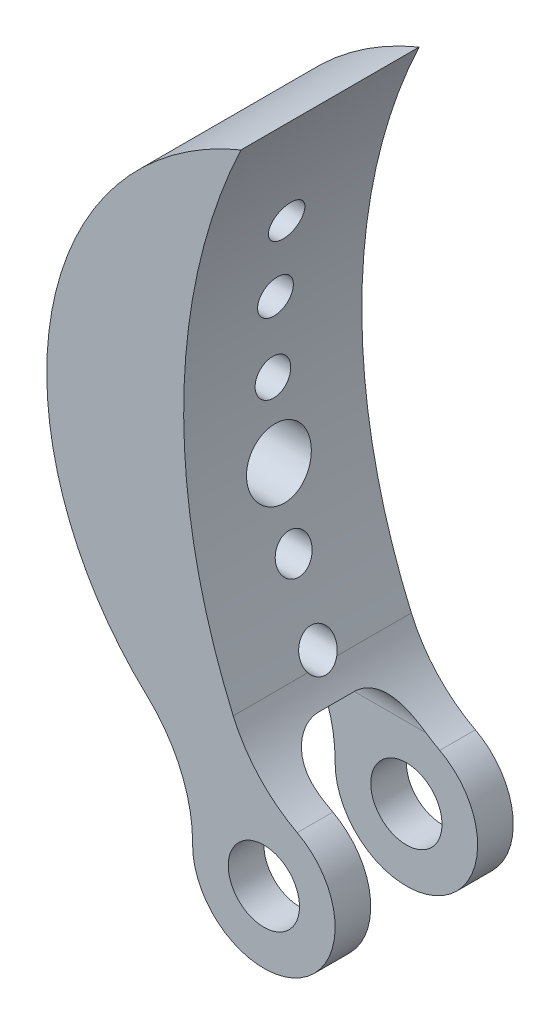
from build123d import *

# Parameters (mm, degrees)
SKETCH1_R                = 2.5
BOSS_EXTRUDE1_DEPTH      = 6.25
BOSS_EXTRUDE2_DEPTH      = 12.5
FILLET2_R                = 10
FILLET3_R                = 10
CUT_EXTRUDE1_START       = -15.233459278
CUT_EXTRUDE1_OUTLINE_R   = 1.25
CUT_EXTRUDE1_OUTLINE_R_2 = 2.25
CUT_EXTRUDE1_DEPTH       = 15.233459278
CUT_EXTRUDE2_DEPTH       = 47.918734753
CUT_EXTRUDE2_DEPTH_BACK  = 47.918734753
SKETCH5_W                = 7.5
SKETCH5_H                = 15
FILLET5_R                = 2.5
SKETCH18_R               = 1.25
CUT_EXTRUDE4_DEPTH       = 5


# Read off the part's stored shape, not the designer's step: Cut-Extrude1
with BuildPart() as part:
    # Sketch1 → Boss-Extrude1 (new, symmetric)
    with BuildSketch(Plane.XY):
        with BuildLine():
            Line((-5, 5), (-5, 0))
            ThreePointArc((-5, 0), (3.535533906, -3.535533906), (0, 5))
            Line((0, 5), (-5, 5))
        make_face()
        Circle(SKETCH1_R, mode=Mode.SUBTRACT)
    extrude(amount=BOSS_EXTRUDE1_DEPTH, both=True)

    # Sketch2 → Boss-Extrude2 (add)
    with BuildSketch(Plane.XY.offset(6.25)):
        with BuildLine():
            Line((-5, 5), (0, 5))
            ThreePointArc((0, 5), (-5.591277584, 24.26974364), (-1.605325779, 43.93437161))
            ThreePointArc((-1.605325779, 43.93437161), (-15.150897111, 25.500229196), (-5, 5))
        make_face()
    extrude(amount=-BOSS_EXTRUDE2_DEPTH)

    # Fillet2
    fillet2_edges = [part.edges().sort_by_distance(p)[0] for p in [
        (-5, 5, 0),
    ]]
    fillet(fillet2_edges, radius=FILLET2_R)

    # Fillet3
    fillet3_edges = [part.edges().sort_by_distance(p)[0] for p in [
        (0, 5, 0),
    ]]
    fillet(fillet3_edges, radius=FILLET3_R)

    # Cut-Extrude1 outline → Cut-Extrude1 (cut)
    with BuildSketch(Plane(origin=(0, 0, 0), x_dir=(0, 0, -1), z_dir=(1, 0, 0)).offset(CUT_EXTRUDE1_START)):
        with Locations((0, 10)):
            Circle(CUT_EXTRUDE1_OUTLINE_R)
        with Locations((0, 5)):
            Circle(CUT_EXTRUDE1_OUTLINE_R)
        with Locations((0, 20)):
            Circle(CUT_EXTRUDE1_OUTLINE_R_2)
        with Locations((0, 30)):
            Circle(CUT_EXTRUDE1_OUTLINE_R)
        with Locations((0, 35)):
            Circle(CUT_EXTRUDE1_OUTLINE_R)
        with Locations((0, 25)):
            Circle(CUT_EXTRUDE1_OUTLINE_R)
        with Locations((0, 15)):
            Circle(CUT_EXTRUDE1_OUTLINE_R)
    extrude(amount=CUT_EXTRUDE1_DEPTH, mode=Mode.SUBTRACT)

    # Sketch5 → Cut-Extrude2 (cut, two sides: drawn at the far end of the back side and taken through both)
    with BuildSketch(Plane(origin=(0, 0, 0), x_dir=(0, 0, -1), z_dir=(1, 0, 0)).offset(-CUT_EXTRUDE2_DEPTH_BACK)):
        Rectangle(SKETCH5_W, SKETCH5_H)
    extrude(amount=CUT_EXTRUDE2_DEPTH + CUT_EXTRUDE2_DEPTH_BACK, mode=Mode.SUBTRACT)

    # Fillet5
    fillet5_edges = [part.edges().sort_by_distance(p)[0] for p in [
        (-4.697845418, 7.5, -3.75),
        (-4.697845418, 7.5, 3.75),
    ]]
    fillet(fillet5_edges, radius=FILLET5_R)

    # Sketch18 → Cut-Extrude4 (cut)
    with BuildSketch(Plane.XZ.offset(-7.5)):
        with Locations(Location((-5.738518824, 0, 0), (0, 0, 270))):
            Circle(SKETCH18_R)
    extrude(amount=-CUT_EXTRUDE4_DEPTH, mode=Mode.SUBTRACT)


solid = part.part
